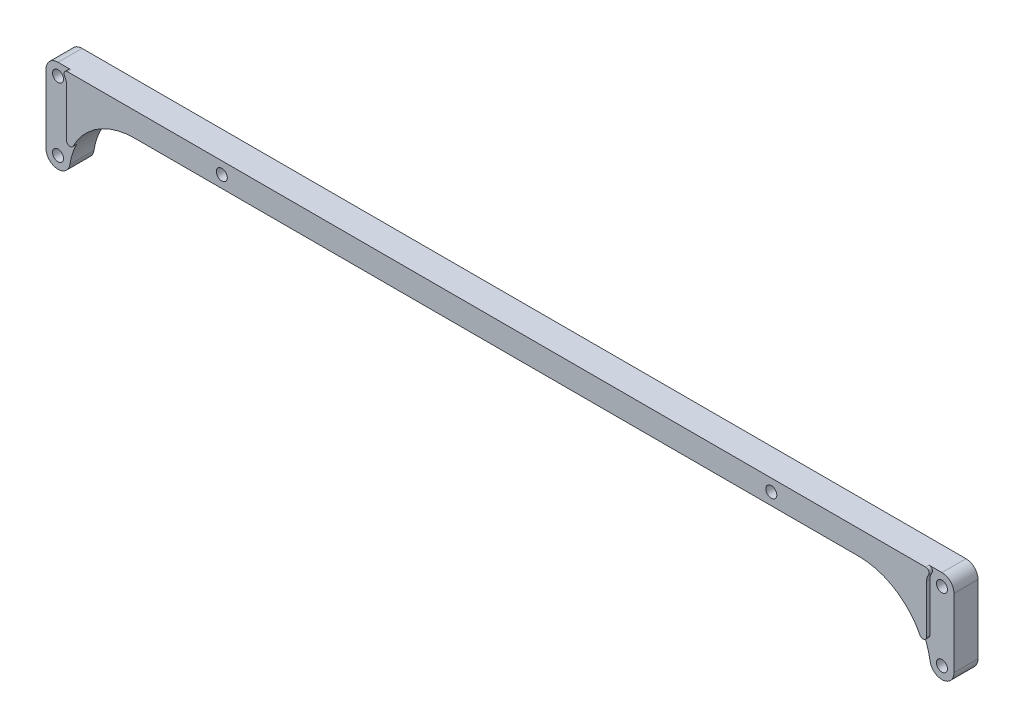
from build123d import *

# Parameters (mm, degrees)
EXTRUDE_1_DEPTH     = 8
CUT_EXTRUDE_1_DEPTH = 1
FILLET_1_R          = 1
HOLE_WIZARD_M3_1_D  = 3.2


with BuildPart() as part:
    # ｽｹｯﾁ1 → ﾎﾞｽ - 押し出し1 (new body)
    with BuildSketch(Plane.XY):
        with BuildLine():
            Line((-128.683849372, 3.5), (128.683849372, 3.5))
            ThreePointArc((128.683849372, 3.5), (131.158723106, 2.474873734), (132.183849372, 0))
            Line((132.183849372, 0), (132.183849372, -20))
            ThreePointArc((132.183849372, -20), (128.945217461, -23.490227317), (125.222885531, -20.521276596))
            ThreePointArc((125.222885531, -20.521276596), (118.492510756, -8.341265421), (105.445949295, -3.5))
            Line((105.445949295, -3.5), (-105.445949295, -3.5))
            ThreePointArc((-105.445949295, -3.5), (-118.492510756, -8.341265421), (-125.222885531, -20.521276596))
            ThreePointArc((-125.222885531, -20.521276596), (-128.945217461, -23.490227317), (-132.183849372, -20))
            Line((-132.183849372, -20), (-132.183849372, 0))
            ThreePointArc((-132.183849372, 0), (-131.158723106, 2.474873734), (-128.683849372, 3.5))
        make_face()
    extrude(amount=-EXTRUDE_1_DEPTH)

    # ｽｹｯﾁ1<4> → ｶｯﾄ - 押し出し1 (cut)
    with BuildSketch(Plane.XY):
        with BuildLine():
            ThreePointArc((-125.183849372, 0), (-126.208975638, 2.474873734), (-128.683849372, 3.5))
            ThreePointArc((-128.683849372, 3.5), (-131.158723106, 2.474873734), (-132.183849372, 0))
            Line((-132.183849372, 0), (-132.183849372, -20))
            ThreePointArc((-132.183849372, -20), (-128.945217461, -23.490227317), (-125.222885531, -20.521276596))
            ThreePointArc((-125.222885531, -20.521276596), (-125.203758298, -20.396939676), (-125.183849372, -20.272725524))
            Line((-125.183849372, -20.272725524), (-125.183849372, 0))
        make_face()
        with BuildLine():
            Line((125.183849372, 0), (125.183849372, -20.272725524))
            ThreePointArc((125.183849372, -20.272725524), (125.203758298, -20.396939676), (125.222885531, -20.521276596))
            ThreePointArc((125.222885531, -20.521276596), (128.945217461, -23.490227317), (132.183849372, -20))
            Line((132.183849372, -20), (132.183849372, 0))
            ThreePointArc((132.183849372, 0), (131.158723106, 2.474873734), (128.683849372, 3.5))
            ThreePointArc((128.683849372, 3.5), (126.208975638, 2.474873734), (125.183849372, 0))
        make_face()
    extrude(amount=-CUT_EXTRUDE_1_DEPTH, mode=Mode.SUBTRACT)

    # ﾌｨﾚｯﾄ1
    fillet_1_edges = [part.edges().sort_by_distance(p)[0] for p in [
        (-128.683849372, 3.5, -0.5),
        (-125.183849372, -20.272725524, -0.5),
        (128.683849372, 3.5, -0.5),
        (125.183849372, -20.272725524, -0.5),
    ]]
    fillet(fillet_1_edges, radius=FILLET_1_R - 0.0001)  # a hair under: the kernel refuses the full size

    # M3 すきま穴1 (through all)
    with Locations(Plane(origin=(-128.683849372, -20, -8), x_dir=(-1, 0, 0), z_dir=(0, 0, -1))):
        with Locations((0, 0), (0, 20), (-48.683849372, 20), (-257.367698744, 0), (-257.367698744, 20), (-208.683849372, 20)):
            Hole(HOLE_WIZARD_M3_1_D / 2)


solid = part.part
